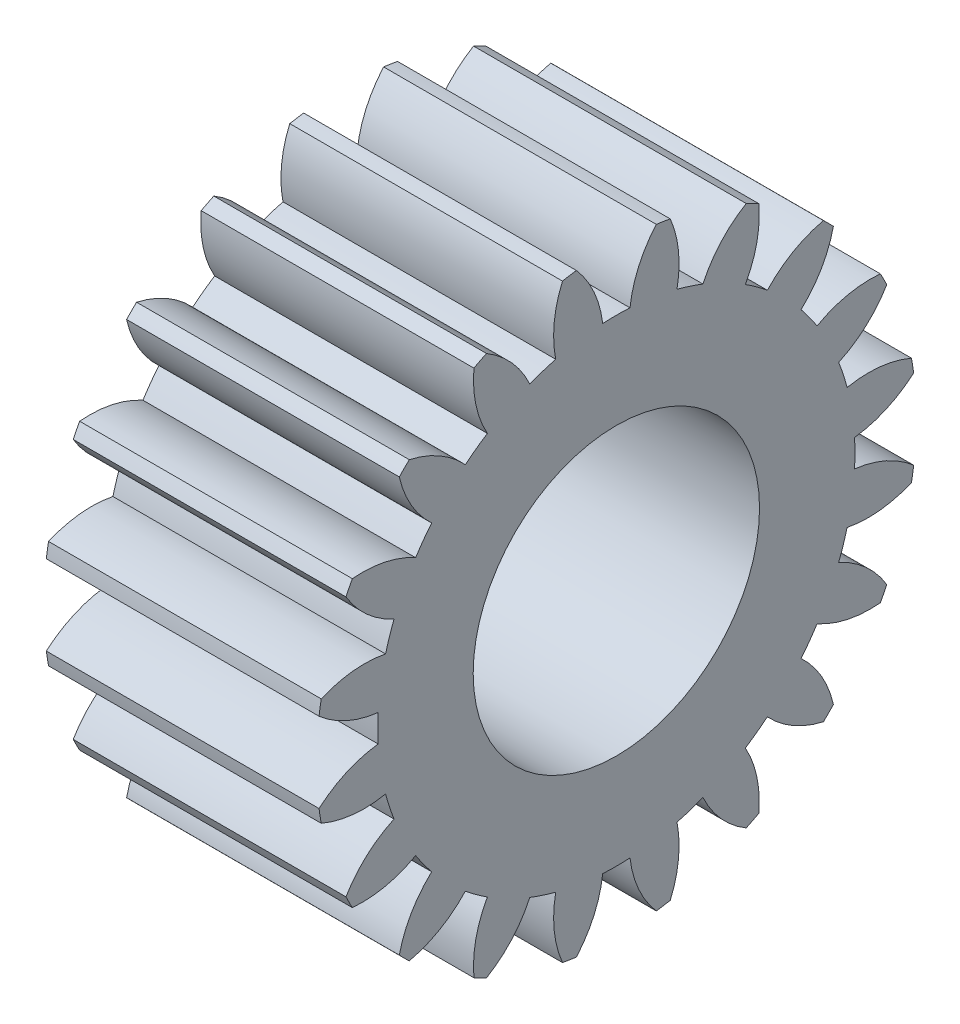
from build123d import *

# Parameters (mm, degrees)
BASPROSKE_W                   = 10
BASPROSKE_H                   = 11
TOOTHCUT_DEPTH                = 19.493242009
TEETHCUTS_COUNT               = 20
TEETHCUTS_ANGLE               = 342
BORSKE_R                      = 0.4
BORE_DEPTH                    = 50.0000508
TALADRO_DE_MARGEN_PARA_M101_D = 10.5


with BuildPart() as part:
    # BasProSke → Base-Revolve (revolve)
    with BuildSketch(Plane(origin=(0, 0, 0), x_dir=(1, 0, 0), z_dir=(0, 1, 0))):
        with Locations((5, 5.5)):
            Rectangle(BASPROSKE_W, BASPROSKE_H)
    revolve(axis=Axis((-10, 0, 0), (1, 0, 0)))

    # TooCutSke → ToothCut (cut, through all)
    with BuildSketch(Plane(origin=(0, 0, 0), x_dir=(0, 0, -1), z_dir=(1, 0, 0))):
        with BuildLine():
            ThreePointArc((0.499924007, 8.734705318), (0, 8.749), (-0.499924007, 8.734705318))
            ThreePointArc((-0.499924007, 8.734705318), (-0.824302243, 9.905497836), (-1.485192705, 10.924909509))
            ThreePointArc((-1.485192705, 10.924909509), (0, 11.0254), (1.485192705, 10.924909509))
            ThreePointArc((1.485192705, 10.924909509), (0.824302243, 9.905497836), (0.499924007, 8.734705318))
        make_face()
    toothcut = extrude(amount=TOOTHCUT_DEPTH, mode=Mode.SUBTRACT)

    # TeethCuts: ToothCut ×20 about axis
    teethcuts_axis = Axis((-10, 0, 0), (1, 0, 0))
    for i in range(1, TEETHCUTS_COUNT):
        add(toothcut.rotate(teethcuts_axis, i * TEETHCUTS_ANGLE / (TEETHCUTS_COUNT - 1)), mode=Mode.SUBTRACT)

    # BorSke → Bore (cut, symmetric)
    with BuildSketch(Plane(origin=(0, 0, 0), x_dir=(0, 0, -1), z_dir=(1, 0, 0))):
        Circle(BORSKE_R)
    extrude(amount=BORE_DEPTH, both=True, mode=Mode.SUBTRACT)

    # Taladro de margen para M101 (through all)
    with Locations(Plane(origin=(10, 0, 0), x_dir=(0, 0, -1), z_dir=(1, 0, 0))):
        with Locations((0, 0)):
            Hole(TALADRO_DE_MARGEN_PARA_M101_D / 2)


solid = part.part
